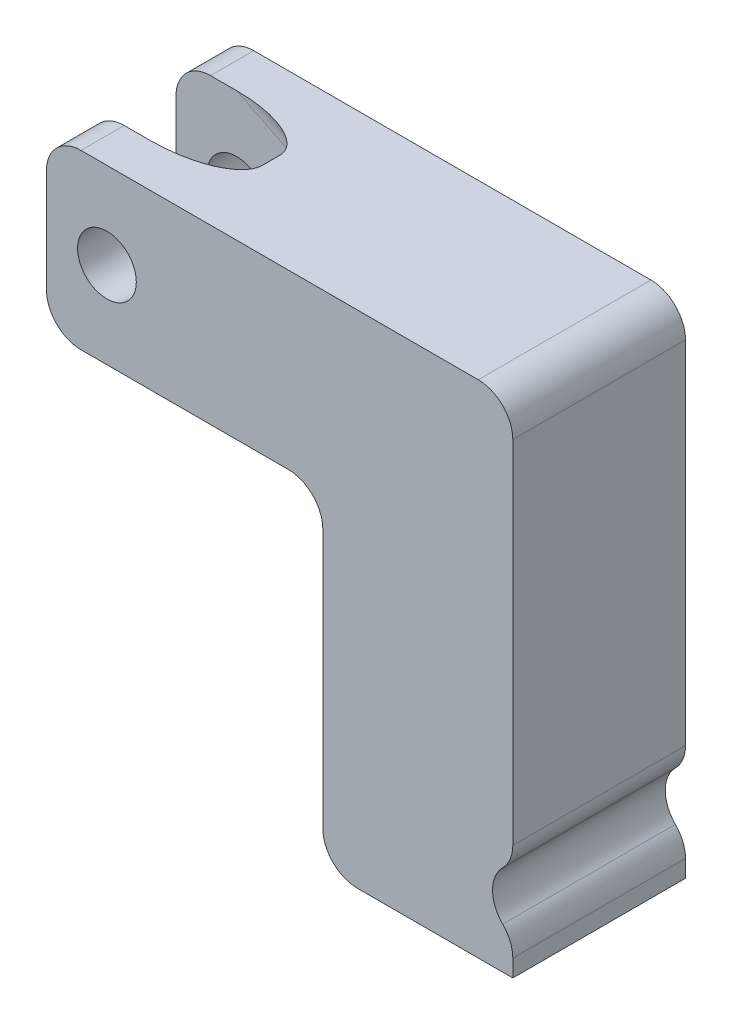
from build123d import *

# Parameters (mm, degrees)
BOSS_EXTRUDE1_DEPTH = 5
SKETCH4_R           = 0.85
CUT_EXTRUDE3_DEPTH  = 21.432816742
SKETCH5_W           = 4
SKETCH5_H           = 2.5
CUT_EXTRUDE4_DEPTH  = 13
FILLET4_R           = 1
CUT_EXTRUDE5_DEPTH  = 21.432816742
FILLET6_R           = 1
CUT_EXTRUDE6_START  = -8.5
CUT_EXTRUDE6_DEPTH  = 7.974174509
SKETCH11_W          = 2.5
SKETCH11_H          = 5
CUT_EXTRUDE8_DEPTH  = 4
SKETCH12_R          = 0.6
CUT_EXTRUDE9_DEPTH  = 5
SKETCH9_R           = 0.25
CUT_EXTRUDE10_DEPTH = 8.5
FILLET7_R           = 1


# Read off the part's stored shape, not the designer's step: Cut-Extrude6
with BuildPart() as part:
    # Sketch1 → Boss-Extrude1 (new body)
    with BuildSketch(Plane.XY):
        Polygon((0, 0), (13.5, 0), (13.5, -14.5), (8, -14.5), (8, -5), (0, -5), align=None)
    extrude(amount=BOSS_EXTRUDE1_DEPTH)

    # Sketch4 → Cut-Extrude3 (cut, through all)
    with BuildSketch(Plane.XY.offset(5)):
        with Locations((1.75, -2.5)):
            Circle(SKETCH4_R)
    extrude(amount=-CUT_EXTRUDE3_DEPTH, mode=Mode.SUBTRACT)

    # Sketch5 → Cut-Extrude4 (cut)
    with BuildSketch(Plane(origin=(0, 0, 0), x_dir=(1, 0, 0), z_dir=(0, 1, 0))):
        with Locations((2, -2.5)):
            Rectangle(SKETCH5_W, SKETCH5_H)
    extrude(amount=-CUT_EXTRUDE4_DEPTH, mode=Mode.SUBTRACT)

    # Fillet4
    fillet4_edges = [part.edges().sort_by_distance(p)[0] for p in [
        (0, 0, 4.375),
        (0, -5, 4.375),
        (0, 0, 0.625),
        (0, -5, 0.625),
    ]]
    fillet(fillet4_edges, radius=FILLET4_R)

    # Sketch6 → Cut-Extrude5 (cut, through all)
    with BuildSketch(Plane.XY.offset(5)):
        Polygon((13.5, -13.588182425), (12.5, -12.588182425), (13.5, -11.588182425), align=None)
    extrude(amount=-CUT_EXTRUDE5_DEPTH, mode=Mode.SUBTRACT)

    # Fillet6
    fillet6_edges = [part.edges().sort_by_distance(p)[0] for p in [
        (12.5, -12.588182425, 2.5),
        (13.5, -13.588182425, 2.5),
        (13.5, -11.588182425, 2.5),
        (8, -5, 2.5),
        (8, -14.5, 2.5),
        (13.5, 0, 2.5),
    ]]
    fillet(fillet6_edges, radius=FILLET6_R - 0.0001)  # a hair under: the kernel refuses the full size

    # Cut-Extrude6 outline → Cut-Extrude6 (cut)
    with BuildSketch(Plane.XZ.offset(14.5).offset(CUT_EXTRUDE6_START)):
        with BuildLine():
            Line((7.999994957, 5.000049402), (7.999994964, 0.302944212))
            ThreePointArc((7.999994964, 0.302944212), (8.119562434, 2.651496807), (7.999994957, 5.000049402))
        make_face()
    extrude(amount=CUT_EXTRUDE6_DEPTH, mode=Mode.SUBTRACT)

    # Sketch11 → Cut-Extrude8 (cut, along a direction that is not the sketch's normal)
    with BuildSketch(Plane.ZY.offset(-4)):
        with Locations((2.5, -2.5)):
            Rectangle(SKETCH11_W, SKETCH11_H)
    extrude(amount=-CUT_EXTRUDE8_DEPTH, dir=(-0.894528038262942, 0.4470118440952684, 0), mode=Mode.SUBTRACT)

    # Sketch12 → Cut-Extrude9 (cut, along a direction that is not the sketch's normal)
    with BuildSketch(Plane.ZY.offset(-8)):
        with Locations((3.671694189, -8.375443102)):
            Circle(SKETCH12_R)
        with Locations((3.671694189, -10.194652501)):
            Circle(SKETCH12_R)
        with Locations((3.671694189, -12.168032187)):
            Circle(SKETCH12_R)
        with Locations((2.5, -6)):
            Circle(SKETCH12_R)
    extrude(amount=-CUT_EXTRUDE9_DEPTH, dir=(-0.894528038262942, 0.4470118440952684, 0), mode=Mode.SUBTRACT)

    # Sketch9 → Cut-Extrude10 (cut)
    with BuildSketch(Plane.XZ.offset(14.5)):
        with Locations((8.119066185, 2.5)):
            Circle(SKETCH9_R)
    extrude(amount=-CUT_EXTRUDE10_DEPTH, mode=Mode.SUBTRACT)

    # Fillet7
    fillet7_edges = [part.edges().sort_by_distance(p)[0] for p in [
        (5.789056077, -0.894023688, 1.25),
        (5.789056077, -0.894023688, 3.75),
        (7.578112153, -3.486020884, 3.75),
        (7.578112153, -3.486020884, 1.25),
    ]]
    fillet(fillet7_edges, radius=FILLET7_R)


solid = part.part
